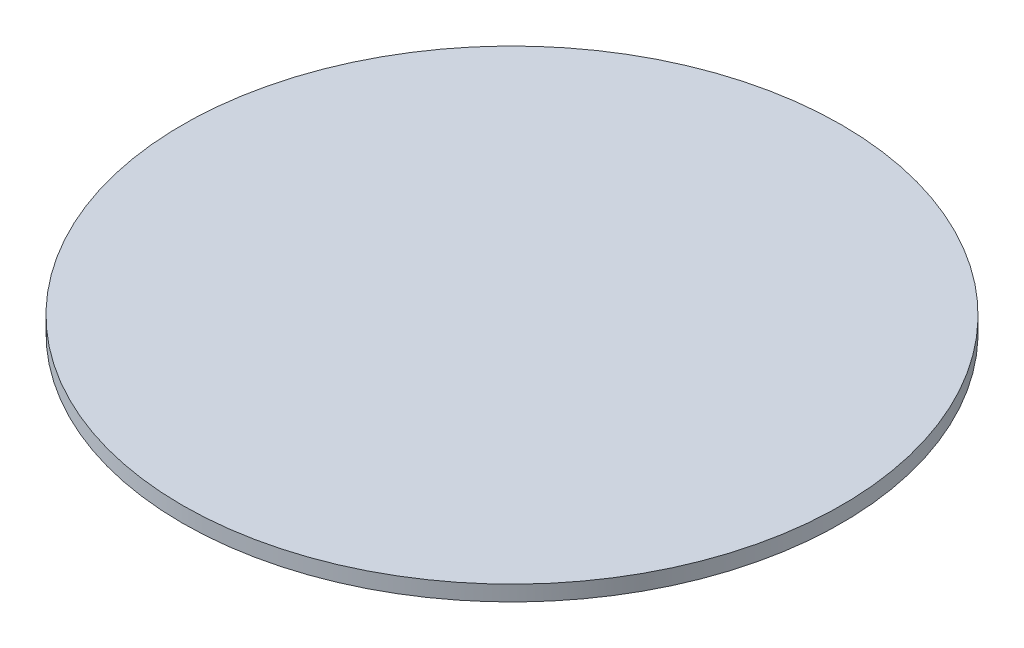
from build123d import *

# Parameters (mm, degrees)
ESBO_O1_R                = 85.4
RESSALTO_EXTRUS_O1_DEPTH = 4


with BuildPart() as part:
    # Esboço1 → Ressalto-extrusão1 (new body)
    with BuildSketch(Plane(origin=(0, 0, 0), x_dir=(1, 0, 0), z_dir=(0, 1, 0))):
        Circle(ESBO_O1_R)
    extrude(amount=RESSALTO_EXTRUS_O1_DEPTH)


solid = part.part
